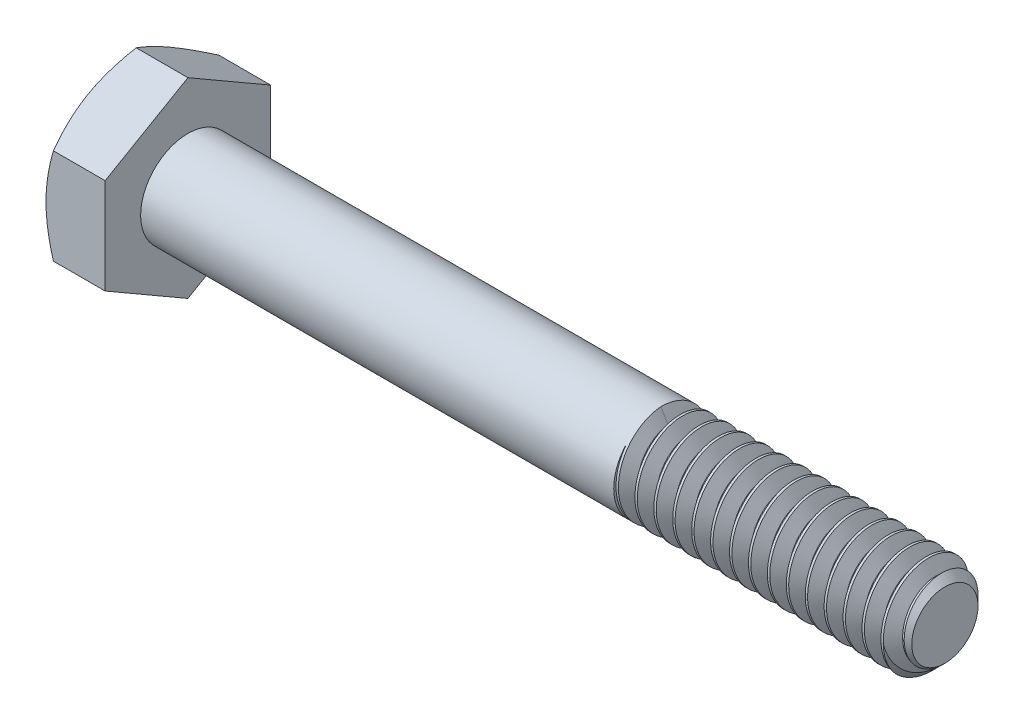
from build123d import *

# Parameters (mm, degrees)
SKETCH5_R           = 3.175
BOSS_EXTRUDE3_DEPTH = 50.8
CHAMFER1_SIZE       = 0.9525
BOSS_EXTRUDE4_DEPTH = 3.96875
SKETCH8_OUTSIDE_W   = 220.032
SKETCH8_OUTSIDE_H   = 221.752
SKETCH8_OUTSIDE_R   = 5.55625
CUT_EXTRUDE3_DEPTH  = 56.422472362
CUT_EXTRUDE3_DRAFT  = -60
CUT_EXTRUDE4_DEPTH  = 0.254
CIRPATTERN1_COUNT   = 6
CUT_SWEEP1_PITCH    = 1.27
CUT_SWEEP1_TO       = 19.05


with BuildPart() as part:
    # Sketch5 → Boss-Extrude3 (new body)
    with BuildSketch(Plane(origin=(27.384375, 0, 0), x_dir=(0, 0, -1), z_dir=(1, 0, 0))):
        Circle(SKETCH5_R)
    extrude(amount=-BOSS_EXTRUDE3_DEPTH)

    # Chamfer1
    chamfer1_edges = [part.edges().sort_by_distance(p)[0] for p in [
        (27.384375, 0, 3.175),
    ]]
    chamfer(chamfer1_edges, length=CHAMFER1_SIZE)

    # Sketch11 → Revolve1 (revolve)
    with BuildSketch(Plane.XY):
        Polygon((-23.415625, 3.175), (-23.415625, 0), (11.509375, 0), (8.334375, 3.175), align=None)
    revolve(axis=Axis((-23.415625, 0, 0), (1, 0, 0)))

    # Sketch6 → Boss-Extrude4 (add)
    with BuildSketch(Plane.ZY.offset(23.415625)):
        Polygon((5.55625, 3.207902433), (0, 6.415804866), (-5.55625, 3.207902433), (-5.55625, -3.207902433), (0, -6.415804866), (5.55625, -3.207902433), align=None)
    extrude(amount=BOSS_EXTRUDE4_DEPTH)


with BuildPart() as cut_extrude3_tool:
    # Sketch8 outside → Cut-Extrude3 (with draft: the straight prism first)
    with BuildSketch(Plane.ZY.offset(27.384375)):
        Rectangle(SKETCH8_OUTSIDE_W, SKETCH8_OUTSIDE_H)
        Circle(SKETCH8_OUTSIDE_R, mode=Mode.SUBTRACT)
    extrude(amount=-CUT_EXTRUDE3_DEPTH)
    # Cut-Extrude3: the draft: its side faces are tilted about the plane it starts from
    cut_extrude3_sides = [cut_extrude3_tool.faces().sort_by_distance(p)[0] for p in [
        (0.826861181, -110.876, 0),
        (0.826861181, 0, 110.016),
        (0.826861181, 110.876, 0),
        (0.826861181, 0, -110.016),
        (0.826861181, 0, -5.55625),
    ]]
    draft(cut_extrude3_sides, Plane.ZY.offset(27.384375), CUT_EXTRUDE3_DRAFT)


with BuildPart() as part_1:
    add(part.part)

    # Cut-Extrude3: cut by cut_extrude3_tool
    add(cut_extrude3_tool.part, mode=Mode.SUBTRACT)

    # Sketch12 → Cut-Extrude4 (cut)
    with BuildSketch(Plane.ZY.offset(27.384375)):
        with BuildLine():
            Line((0.1666875, 4.2783125), (0.1666875, 2.3891875))
            ThreePointArc((0.1666875, 2.3891875), (0, 2.2225), (-0.1666875, 2.3891875))
            Line((-0.1666875, 2.3891875), (-0.1666875, 4.2783125))
            ThreePointArc((-0.1666875, 4.2783125), (0, 4.445), (0.1666875, 4.2783125))
        make_face()
    cut_extrude4 = extrude(amount=-CUT_EXTRUDE4_DEPTH, mode=Mode.SUBTRACT)

    # CirPattern1: Cut-Extrude4 ×6 about axis
    cirpattern1_axis = Axis((0, 0, 0), (1, 0, 0))
    for i in range(1, CIRPATTERN1_COUNT):
        add(cut_extrude4.rotate(cirpattern1_axis, i * 360 / CIRPATTERN1_COUNT), mode=Mode.SUBTRACT)


with BuildPart() as body_2:
    # Split1: the piece on the far side of the plane
    add(part_1.part)
    split(bisect_by=Plane(origin=(8.334375, 0, 0), x_dir=(0, 0, 1), z_dir=(1, 0, 0)), keep=Keep.BOTTOM)


with BuildPart() as part_2:
    add(part_1.part)

    # Split1
    split(bisect_by=Plane(origin=(8.334375, 0, 0), x_dir=(0, 0, 1), z_dir=(1, 0, 0)), keep=Keep.TOP)

    # Cut-Sweep1: arcs per turn and ends read off the stored shape
    # Cut-Sweep1: the profile of Sketch10 profile screwed along a right-hand helix through 16 turns, 8 arcs to a turn; built about Z, then put on its axis
    cut_sweep1_z = Axis((0, 0, 0), (0, 0, 1))
    cut_sweep1_corners = [(3.1753, 0, 0.000173205), (2.350110803, 0, -0.47625), (2.350110803, 0, -0.635), (3.1753, 0, -1.111423205)]
    with BuildLine(mode=Mode.PRIVATE) as cut_sweep1_profile:
        Line(cut_sweep1_corners[0], cut_sweep1_corners[1])
        Line(cut_sweep1_corners[1], cut_sweep1_corners[2])
        Line(cut_sweep1_corners[2], cut_sweep1_corners[3])
        Line(cut_sweep1_corners[3], cut_sweep1_corners[0])
    cut_sweep1_cap = Face(cut_sweep1_profile.wire())
    cut_sweep1_turn_angles = [0, 22.5, 45, 67.5, 90, 112.5, 135, 157.5, 180, 202.5, 225, 247.5, 270, 292.5, 315, 337.5, 360]
    cut_sweep1_turn_weights = [1, 0.9238795325112867, 1, 0.9238795325112867, 1, 0.9238795325112867, 1, 0.9238795325112867, 1, 0.9238795325112867, 1, 0.9238795325112867, 1, 0.9238795325112867, 1, 0.9238795325112867, 1]
    cut_sweep1_turn_rails = [Edge.make_bspline([Vector(p[0], p[1], 0).rotate(cut_sweep1_z, cut_sweep1_turn_angles[k]) / cut_sweep1_turn_weights[k] + Vector(0, 0, p[2] + CUT_SWEEP1_PITCH * cut_sweep1_turn_angles[k] / 360) for k in range(17)], [0, 0, 0, 1, 1, 2, 2, 3, 3, 4, 4, 5, 5, 6, 6, 7, 7, 8, 8, 8], 2, cut_sweep1_turn_weights) for p in cut_sweep1_corners]
    cut_sweep1_turn_sides = [Face.make_surface_from_curves(cut_sweep1_turn_rails[p[0]], cut_sweep1_turn_rails[p[1]]) for p in [(0, 1), (1, 2), (2, 3), (3, 0)]]
    cut_sweep1 = Plane(origin=(27.384375, 0, 0), x_dir=(0, 1, 0), z_dir=(-1, 0, 0)) * split(Solid(Shell([*[p.moved(Location((0, 0, CUT_SWEEP1_PITCH * i))) for i in range(16) for p in cut_sweep1_turn_sides], cut_sweep1_cap, cut_sweep1_cap.rotate(cut_sweep1_z, 5760).moved(Location((0, 0, CUT_SWEEP1_PITCH * 5760 / 360)))])), bisect_by=Plane.XY.offset(CUT_SWEEP1_TO), keep=Keep.BOTTOM, mode=Mode.PRIVATE)
    add(cut_sweep1, mode=Mode.SUBTRACT)


with BuildPart() as boss_extrude5_tool:
    # Boss-Extrude5: read off the stored shape, not the designer's step
    # Boss-Extrude5 outline → Boss-Extrude5 (revolve)
    with BuildSketch(Plane.YX):
        Polygon((3.175, 8.334375), (2.35010135, 8.810630458), (2.35010135, 8.334375), align=None)
    revolve(axis=Axis((0, 0, 0), (1, 0, 0)))


with BuildPart() as part_3:
    add(part_2.part)


with BuildPart() as part_4:
    # Boss-Extrude5: joined with boss_extrude5_tool
    add(part_3.part.fuse(boss_extrude5_tool.part, body_2.part, tol=0.00001))


solid = part_4.part
